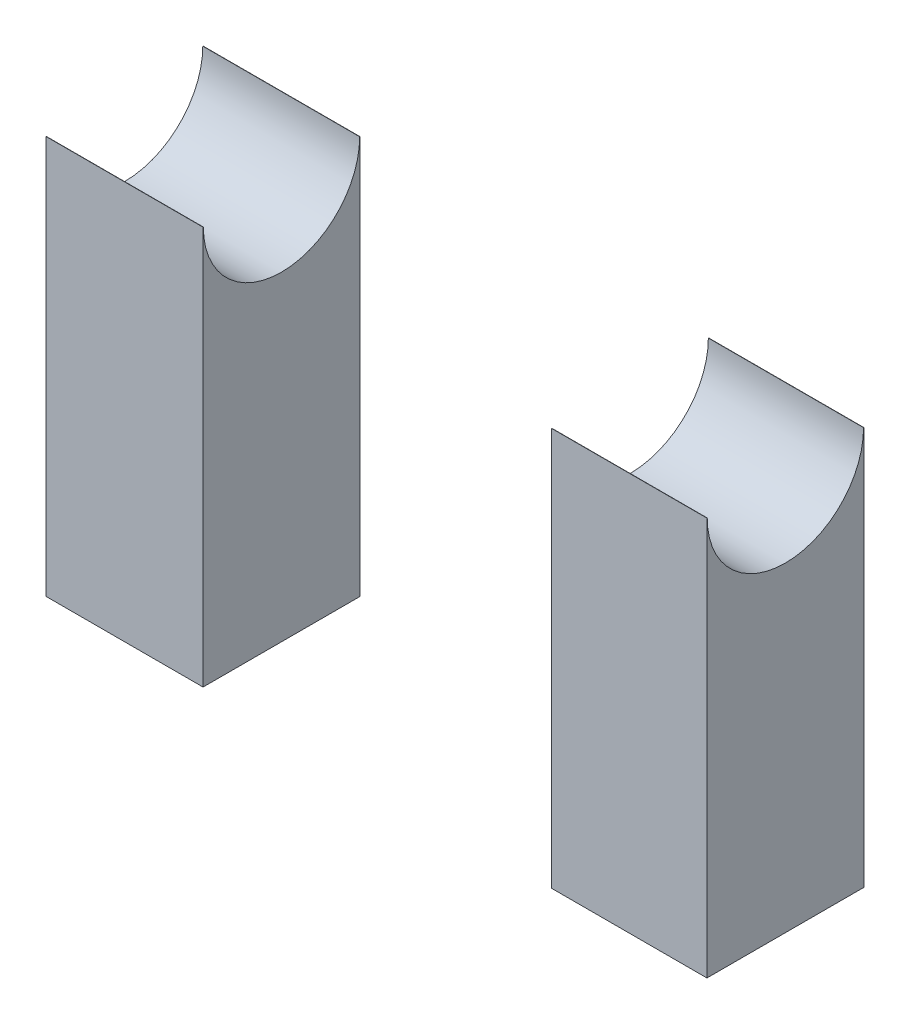
from build123d import *

# Parameters (mm, degrees)
SKIZZE1_W                         = 4.5
SKIZZE1_H                         = 11.423295
AUFSATZ_LINEAR_AUSTRAGEN1_DEPTH   = 4.5
SKIZZE1_W_2                       = 4.451373
AUFSATZ_LINEAR_AUSTRAGEN1_2_DEPTH = 4.5
SKIZZE2_R                         = 2.242170694
SCHNITT_LINEAR_AUSTRAGEN1_DEPTH   = 20


with BuildPart() as part:
    # Skizze1 → Aufsatz-Linear austragen1 (new body)
    with BuildSketch(Plane.XY):
        with Locations((-2.25, 5.7116475)):
            Rectangle(SKIZZE1_W, SKIZZE1_H)
    extrude(amount=AUFSATZ_LINEAR_AUSTRAGEN1_DEPTH)


with BuildPart() as body_2:
    # Skizze1 → Aufsatz-Linear austragen1 2 (new body)
    with BuildSketch(Plane.XY):
        with Locations((12.2256865, 5.7116475)):
            Rectangle(SKIZZE1_W_2, SKIZZE1_H)
    extrude(amount=AUFSATZ_LINEAR_AUSTRAGEN1_2_DEPTH)


with BuildPart() as schnitt_linear_austragen1_tool:
    # Skizze2 → Schnitt-Linear austragen1 (new body)
    with BuildSketch(Plane.ZY.offset(4.5)):
        with Locations((2.25, 11.423295)):
            Circle(SKIZZE2_R)
    extrude(amount=-SCHNITT_LINEAR_AUSTRAGEN1_DEPTH)


with BuildPart() as part_1:
    add(part.part)

    # Schnitt-Linear austragen1: cut by schnitt_linear_austragen1_tool
    add(schnitt_linear_austragen1_tool.part, mode=Mode.SUBTRACT)


with BuildPart() as body_2_1:
    add(body_2.part)

    # Schnitt-Linear austragen1: cut by schnitt_linear_austragen1_tool
    add(schnitt_linear_austragen1_tool.part, mode=Mode.SUBTRACT)


solid = Compound([part_1.part, body_2_1.part])
